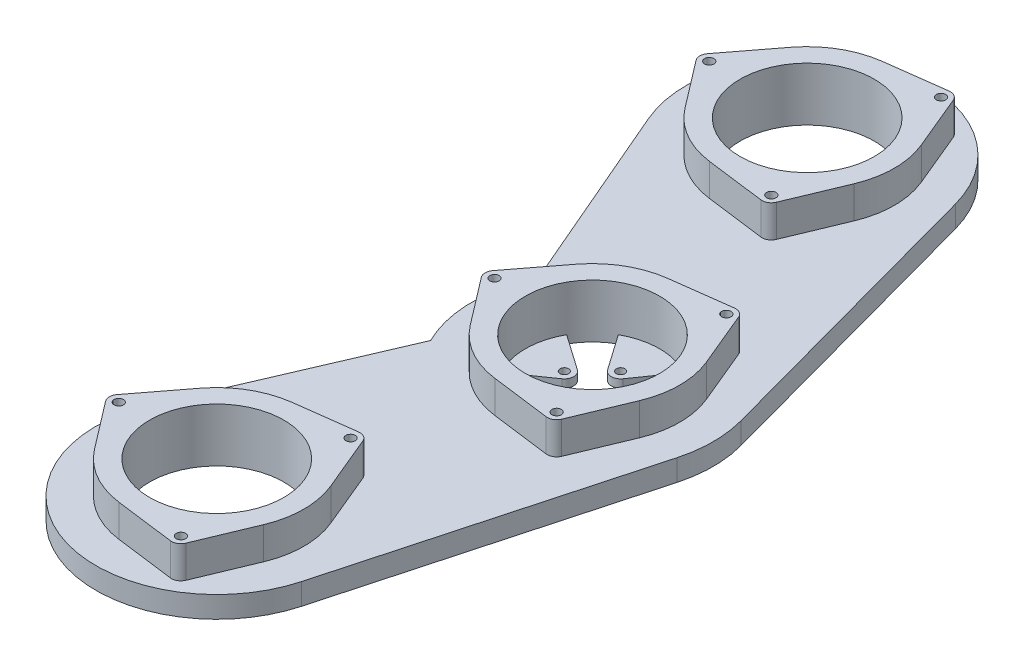
from build123d import *

# Parameters (mm, degrees)
SALIENTE_EXTRUIR1_DEPTH    = 8
SALIENTE_EXTRUIR2_DEPTH    = 12
CORTAR_EXTRUIR3_DEPTH      = 173.609385608
CORTAR_EXTRUIR3_DEPTH_BACK = 173.609385608
CROQUIS7_R                 = 25
CROQUIS7_R_2               = 1.75
SALIENTE_EXTRUIR4_START    = -3
SALIENTE_EXTRUIR4_DEPTH    = 3
CROQUIS10_R                = 1.6
CORTAR_EXTRUIR4_DEPTH      = 173.609385608


with BuildPart() as part:
    # Croquis1 → Saliente-Extruir1 (new body)
    with BuildSketch(Plane(origin=(0, 0, 0), x_dir=(1, 0, 0), z_dir=(0, 1, 0))):
        with BuildLine():
            Line((-71.345800689, 92.236983213), (-40.311288741, 20))
            ThreePointArc((-40.311288741, 20), (-45, 0), (-40.311288741, -20))
            Line((-40.311288741, -20), (-71.345800689, -92.236983213))
            ThreePointArc((-71.345800689, -92.236983213), (-44.837742086, -152.483425118), (13.414371956, -121.840283261))
            Line((13.414371956, -121.840283261), (43.414371956, -11.840283261))
            ThreePointArc((43.414371956, -11.840283261), (45, 0), (43.414371956, 11.840283261))
            Line((43.414371956, 11.840283261), (13.414371956, 121.840283261))
            ThreePointArc((13.414371956, 121.840283261), (-44.837742086, 152.483425118), (-71.345800689, 92.236983213))
        make_face()
    extrude(amount=SALIENTE_EXTRUIR1_DEPTH)

    # Croquis6 → Saliente-Extruir2 (add)
    with BuildSketch(Plane(origin=(0, 8, 0), x_dir=(1, 0, 0), z_dir=(0, 1, 0))):
        with BuildLine():
            Line((-39.280821918, 2.125330436), (-25.821917808, 19.73521119))
            ThreePointArc((-25.821917808, 19.73521119), (-16.25, 28.145825623), (-4.180235335, 32.230042391))
            Line((-4.180235335, 32.230042391), (17.79982081, 35.08085488))
            ThreePointArc((17.79982081, 35.08085488), (20, 34.641016151), (21.481001108, 32.955524444))
            Line((21.481001108, 32.955524444), (30.002153144, 12.494831201))
            ThreePointArc((30.002153144, 12.494831201), (32.5, 0), (30.002153144, -12.494831201))
            Line((30.002153144, -12.494831201), (21.481001108, -32.955524444))
            ThreePointArc((21.481001108, -32.955524444), (20, -34.641016151), (17.79982081, -35.08085488))
            Line((17.79982081, -35.08085488), (-4.180235335, -32.230042391))
            ThreePointArc((-4.180235335, -32.230042391), (-16.25, -28.145825623), (-25.821917808, -19.73521119))
            Line((-25.821917808, -19.73521119), (-39.280821918, -2.125330436))
            ThreePointArc((-39.280821918, -2.125330436), (-40, 0), (-39.280821918, 2.125330436))
        make_face()
        with BuildLine():
            Line((-69.280821918, -107.874669564), (-55.821917808, -90.26478881))
            ThreePointArc((-55.821917808, -90.26478881), (-46.25, -81.854174377), (-34.180235335, -77.769957609))
            Line((-34.180235335, -77.769957609), (-12.20017919, -74.91914512))
            ThreePointArc((-12.20017919, -74.91914512), (-10, -75.358983849), (-8.518998892, -77.044475556))
            Line((-8.518998892, -77.044475556), (0.002153144, -97.505168799))
            ThreePointArc((0.002153144, -97.505168799), (2.5, -110), (0.002153144, -122.494831201))
            Line((0.002153144, -122.494831201), (-8.518998892, -142.955524444))
            ThreePointArc((-8.518998892, -142.955524444), (-10, -144.641016151), (-12.20017919, -145.08085488))
            Line((-12.20017919, -145.08085488), (-34.180235335, -142.230042391))
            ThreePointArc((-34.180235335, -142.230042391), (-46.25, -138.145825623), (-55.821917808, -129.73521119))
            Line((-55.821917808, -129.73521119), (-69.280821918, -112.125330436))
            ThreePointArc((-69.280821918, -112.125330436), (-70, -110), (-69.280821918, -107.874669564))
        make_face()
        with BuildLine():
            Line((-69.280821918, 107.874669564), (-55.821917808, 90.26478881))
            ThreePointArc((-55.821917808, 90.26478881), (-46.25, 81.854174377), (-34.180235335, 77.769957609))
            Line((-34.180235335, 77.769957609), (-12.20017919, 74.91914512))
            ThreePointArc((-12.20017919, 74.91914512), (-10, 75.358983849), (-8.518998892, 77.044475556))
            Line((-8.518998892, 77.044475556), (0.002153144, 97.505168799))
            ThreePointArc((0.002153144, 97.505168799), (2.5, 110), (0.002153144, 122.494831201))
            Line((0.002153144, 122.494831201), (-8.518998892, 142.955524444))
            ThreePointArc((-8.518998892, 142.955524444), (-10, 144.641016151), (-12.20017919, 145.08085488))
            Line((-12.20017919, 145.08085488), (-34.180235335, 142.230042391))
            ThreePointArc((-34.180235335, 142.230042391), (-46.25, 138.145825623), (-55.821917808, 129.73521119))
            Line((-55.821917808, 129.73521119), (-69.280821918, 112.125330436))
            ThreePointArc((-69.280821918, 112.125330436), (-70, 110), (-69.280821918, 107.874669564))
        make_face()
    extrude(amount=SALIENTE_EXTRUIR2_DEPTH)

    # Croquis7 → Cortar-Extruir3 (cut, two sides: drawn at the far end of the back side and taken through both)
    with BuildSketch(Plane(origin=(0, 8, 0), x_dir=(1, 0, 0), z_dir=(0, 1, 0)).offset(-CORTAR_EXTRUIR3_DEPTH_BACK)):
        Circle(CROQUIS7_R)
        with Locations((-30, 110)):
            Circle(CROQUIS7_R)
        with Locations((-30, -110)):
            Circle(CROQUIS7_R)
        with Locations((-36.5, 0)):
            Circle(CROQUIS7_R_2)
        with Locations((18.25, -31.609927238)):
            Circle(CROQUIS7_R_2)
        with Locations((18.25, 31.609927238)):
            Circle(CROQUIS7_R_2)
        with Locations((-11.75, 141.609927238)):
            Circle(CROQUIS7_R_2)
        with Locations((-66.5, 110)):
            Circle(CROQUIS7_R_2)
        with Locations((-11.75, 78.390072762)):
            Circle(CROQUIS7_R_2)
        with Locations((-66.5, -110)):
            Circle(CROQUIS7_R_2)
        with Locations((-11.75, -141.609927238)):
            Circle(CROQUIS7_R_2)
        with Locations((-11.75, -78.390072762)):
            Circle(CROQUIS7_R_2)
    extrude(amount=CORTAR_EXTRUIR3_DEPTH + CORTAR_EXTRUIR3_DEPTH_BACK, mode=Mode.SUBTRACT)

    # Croquis9 → Saliente-Extruir4 (add)
    with BuildSketch(Plane.XZ.offset(SALIENTE_EXTRUIR4_START)):
        with BuildLine():
            Line((-2.867032155, 8.492482473), (-12.199873602, 21.821161383))
            ThreePointArc((-12.199873602, 21.821161383), (0, 25), (12.199873602, 21.821161383))
            Line((12.199873602, 21.821161383), (2.867032155, 8.492482473))
            ThreePointArc((2.867032155, 8.492482473), (0, 7), (-2.867032155, 8.492482473))
        make_face()
        with BuildLine():
            Line((8.492482473, 2.867032155), (21.821161383, 12.199873602))
            ThreePointArc((21.821161383, 12.199873602), (25, 0), (21.821161383, -12.199873602))
            Line((21.821161383, -12.199873602), (8.492482473, -2.867032155))
            ThreePointArc((8.492482473, -2.867032155), (7, 0), (8.492482473, 2.867032155))
        make_face()
        with BuildLine():
            Line((2.867032155, -8.492482473), (12.199873602, -21.821161383))
            ThreePointArc((12.199873602, -21.821161383), (0, -25), (-12.199873602, -21.821161383))
            Line((-12.199873602, -21.821161383), (-2.867032155, -8.492482473))
            ThreePointArc((-2.867032155, -8.492482473), (0, -7), (2.867032155, -8.492482473))
        make_face()
        with BuildLine():
            Line((-8.492482473, -2.867032155), (-21.821161383, -12.199873602))
            ThreePointArc((-21.821161383, -12.199873602), (-25, 0), (-21.821161383, 12.199873602))
            Line((-21.821161383, 12.199873602), (-8.492482473, 2.867032155))
            ThreePointArc((-8.492482473, 2.867032155), (-7, 0), (-8.492482473, -2.867032155))
        make_face()
    extrude(amount=SALIENTE_EXTRUIR4_DEPTH)

    # Croquis10 → Cortar-Extruir4 (cut, through all)
    with BuildSketch(Plane(origin=(0, 8, 0), x_dir=(1, 0, 0), z_dir=(0, 1, 0))):
        with Locations((-10.5, 0)):
            Circle(CROQUIS10_R)
        with Locations((0, -10.5)):
            Circle(CROQUIS10_R)
        with Locations((10.5, 0)):
            Circle(CROQUIS10_R)
        with Locations((0, 10.5)):
            Circle(CROQUIS10_R)
    extrude(amount=-CORTAR_EXTRUIR4_DEPTH, mode=Mode.SUBTRACT)


solid = part.part
